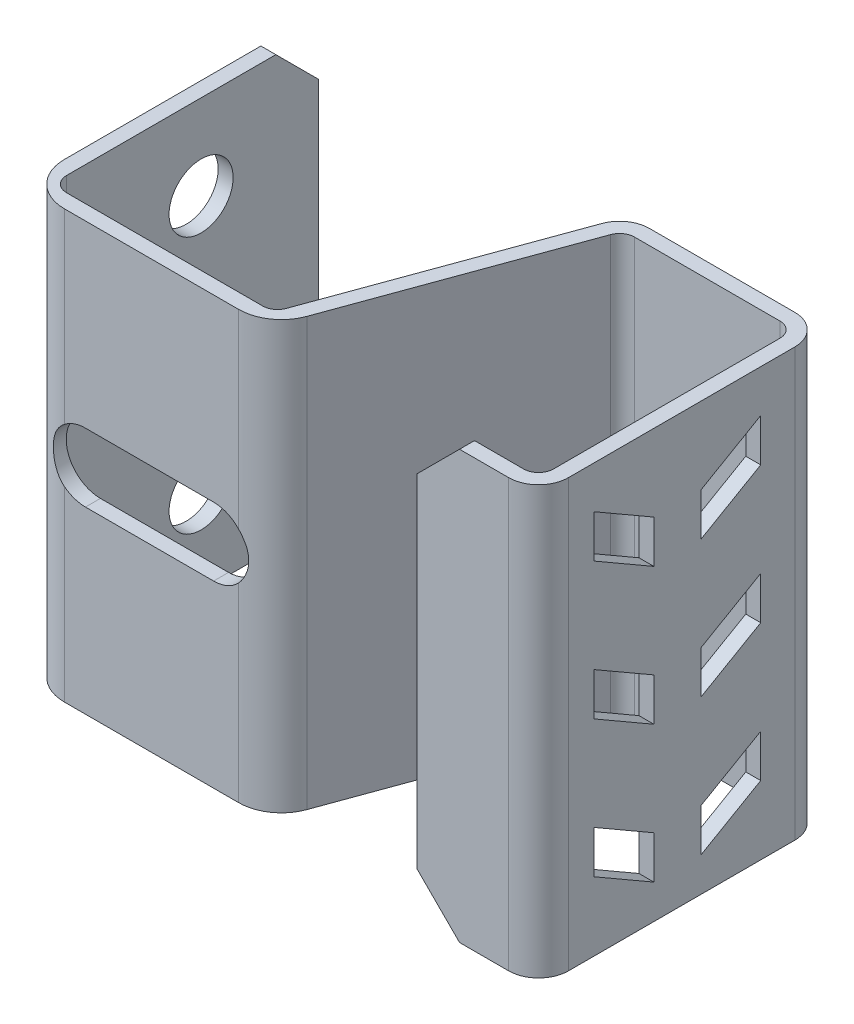
from build123d import *

# Parameters (mm, degrees)
BOSS_EXTRUDE2_DEPTH = 100
CHAMFER1_SIZE       = 10
SKETCH2_R           = 7.5
CUT_EXTRUDE1_DEPTH  = 3.5
CUT_EXTRUDE2_DEPTH  = 3.5
CUT_EXTRUDE3_DEPTH  = 10
FILLET1_R           = 10


with BuildPart() as part:
    # Sketch1 → Boss-Extrude2 (new body)
    with BuildSketch(Plane(origin=(0, 0, 0), x_dir=(1, 0, 0), z_dir=(0, 1, 0))):
        with BuildLine():
            Line((0, 0), (21.5, 0))
            ThreePointArc((21.5, 0), (23.974873734, 1.025126266), (25, 3.5))
            Line((25, 3.5), (25, 56.5))
            ThreePointArc((25, 56.5), (23.974873734, 58.974873734), (21.5, 60))
            Line((21.5, 60), (-12.549273616, 60))
            ThreePointArc((-12.549273616, 60), (-14.556791143, 59.367032155), (-15.838197789, 57.697070502))
            Line((-15.838197789, 57.697070502), (-37.20218429, -1))
            Line((-37.20218429, -1), (-95, -1))
            Line((-95, -1), (-95, 65))
            Line((-95, 65), (-91.5, 65))
            Line((-91.5, 65), (-91.5, 6))
            ThreePointArc((-91.5, 6), (-90.474873734, 3.525126266), (-88, 2.5))
            Line((-88, 2.5), (-42.103637058, 2.5))
            ThreePointArc((-42.103637058, 2.5), (-40.09611953, 3.132967845), (-38.814712885, 4.802929498))
            Line((-38.814712885, 4.802929498), (-19.127121962, 58.894141003))
            ThreePointArc((-19.127121962, 58.894141003), (-16.564308671, 62.23406431), (-12.549273616, 63.5))
            Line((-12.549273616, 63.5), (21.5, 63.5))
            ThreePointArc((21.5, 63.5), (26.449747468, 61.449747468), (28.5, 56.5))
            Line((28.5, 56.5), (28.5, 3.5))
            ThreePointArc((28.5, 3.5), (26.449747468, -1.449747468), (21.5, -3.5))
            Line((21.5, -3.5), (0, -3.5))
            Line((0, -3.5), (0, 0))
        make_face()
    extrude(amount=BOSS_EXTRUDE2_DEPTH)

    # Chamfer1
    chamfer1_edges = [part.edges().sort_by_distance(p)[0] for p in [
        (-93.25, 0, -65),
        (0, 0, 1.75),
        (0, 100, 1.75),
        (-93.25, 100, -65),
    ]]
    chamfer(chamfer1_edges, length=CHAMFER1_SIZE)

    # Sketch2 → Cut-Extrude1 (cut)
    with BuildSketch(Plane.ZY.offset(95)):
        with Locations((-37.5, 19.9)):
            Circle(SKETCH2_R)
        with Locations((-37.5, 80.1)):
            Circle(SKETCH2_R)
    extrude(amount=-CUT_EXTRUDE1_DEPTH, mode=Mode.SUBTRACT)

    # Sketch3 → Cut-Extrude2 (cut)
    with BuildSketch(Plane(origin=(0, 0, -2.5), x_dir=(-1, 0, 0), z_dir=(0, 0, -1))):
        with BuildLine():
            Line((50.069082037, 58), (80.069082037, 58))
            ThreePointArc((80.069082037, 58), (88.069082037, 50), (80.069082037, 42))
            Line((80.069082037, 42), (50.069082037, 42))
            ThreePointArc((50.069082037, 42), (42.069082037, 50), (50.069082037, 58))
        make_face()
    extrude(amount=-CUT_EXTRUDE2_DEPTH, mode=Mode.SUBTRACT)

    # Sketch4 → Cut-Extrude3 (cut)
    with BuildSketch(Plane(origin=(28.5, 0, 0), x_dir=(0, 0, -1), z_dir=(1, 0, 0))):
        Polygon((48.5, 26.082903769), (48.5, 16.082903769), (34.5, 8), (34.5, 18), align=None)
        Polygon((23.5, 18), (23.5, 8), (9.5, 16.082903769), (9.5, 26.082903769), align=None)
        Polygon((48.5, 58.082903769), (48.5, 48.082903769), (34.5, 40), (34.5, 50), align=None)
        Polygon((23.5, 50), (23.5, 40), (9.5, 48.082903769), (9.5, 58.082903769), align=None)
        Polygon((48.5, 90.082903769), (48.5, 80.082903769), (34.5, 72), (34.5, 82), align=None)
        Polygon((23.5, 82), (23.5, 72), (9.5, 80.082903769), (9.5, 90.082903769), align=None)
    extrude(amount=-CUT_EXTRUDE3_DEPTH, mode=Mode.SUBTRACT)

    # Fillet1
    # the kernel refuses this fillet: 10 mm, written as the material it takes off along each edge
    with BuildSketch(Plane(origin=(-37.20218429, -17.505188455, 1), x_dir=(0.3420201433256651, 0, -0.9396926207859098), z_dir=(0, 1, 0))) as fillet1_piece_1:
        with BuildLine():
            CenterArc((FILLET1_R * 0.70020753821, FILLET1_R), FILLET1_R, 200, 70)
            Line((-FILLET1_R * 0.239485082576, FILLET1_R * 0.657979856674), (0, 0))
            Line((0, 0), (FILLET1_R * 0.70020753821, 0))
        make_face()
    extrude(amount=135.01037691, mode=Mode.SUBTRACT)
    with BuildSketch(Plane(origin=(-95, -25, 1), x_dir=(1, 0, 0), z_dir=(0, 1, 0))) as fillet1_piece_2:
        with BuildLine():
            CenterArc((FILLET1_R, FILLET1_R), FILLET1_R, 180, 90)
            Line((0, FILLET1_R), (0, 0))
            Line((0, 0), (FILLET1_R, 0))
        make_face()
    extrude(amount=150, mode=Mode.SUBTRACT)


solid = part.part
